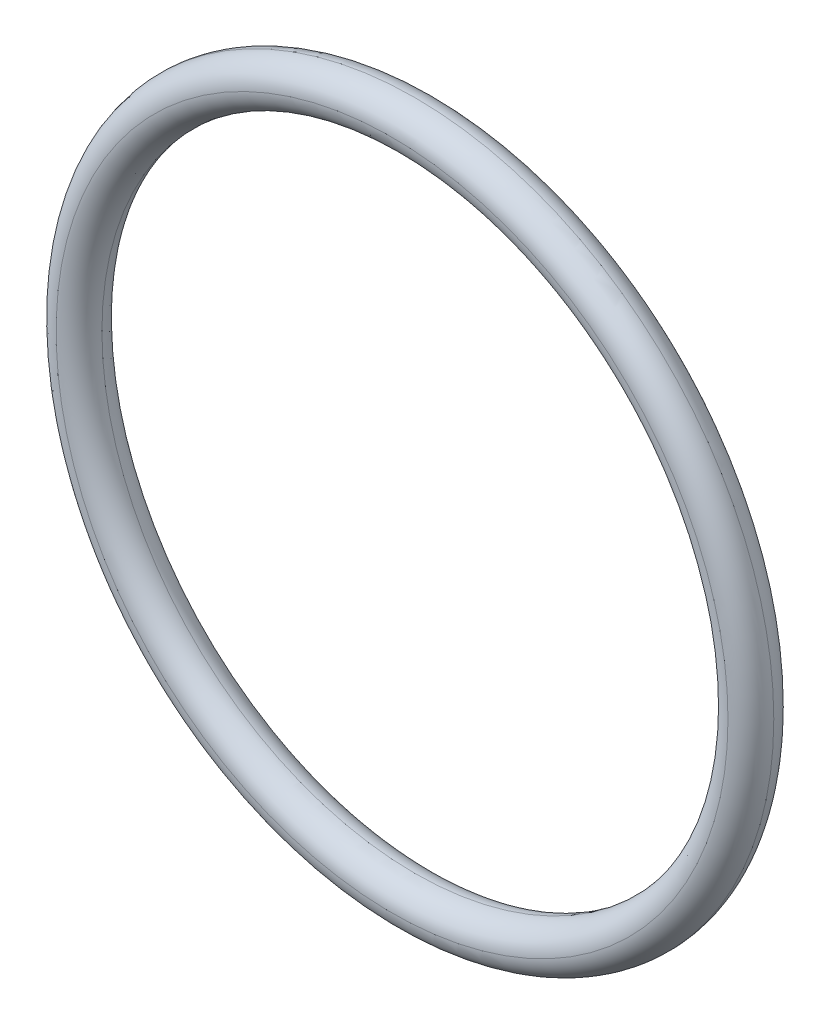
from build123d import *

# Parameters (mm, degrees)
SKETCH1_R               = 7.8613
SKETCH1_R_2             = 6.858
BOSS_EXTRUDE1_DEPTH     = 2.0066
CUT_EXTRUDE1_DEPTH      = 12.297190754
CUT_EXTRUDE1_DEPTH_BACK = 12.297190754
SKETCH2_W               = 1.0033
SKETCH2_H               = 15.7226
FILLET1_R               = 0.50165
FILLET2_R               = 0.50165


with BuildPart() as part:
    # Sketch1 → Boss-Extrude1 (new body)
    with BuildSketch(Plane.XY):
        Circle(SKETCH1_R)
        Circle(SKETCH1_R_2, mode=Mode.SUBTRACT)
    extrude(amount=-BOSS_EXTRUDE1_DEPTH)

    # Sketch2 → Cut-Extrude1 (cut, two sides: drawn at the far end of the back side and taken through both)
    with BuildSketch(Plane(origin=(0, 0, 0), x_dir=(0, 0, -1), z_dir=(1, 0, 0)).offset(-CUT_EXTRUDE1_DEPTH_BACK)):
        with Locations((1.50495, 0)):
            Rectangle(SKETCH2_W, SKETCH2_H)
    extrude(amount=CUT_EXTRUDE1_DEPTH + CUT_EXTRUDE1_DEPTH_BACK, mode=Mode.SUBTRACT)

    # Fillet1
    fillet1_edges = [part.edges().sort_by_distance(p)[0] for p in [
        (-6.858, 0, -1.0033),
        (-7.8613, 0, 0),
        (-6.858, 0, 0),
    ]]
    fillet(fillet1_edges, radius=FILLET1_R - 0.0001)  # a hair under: the kernel refuses the full size

    # Fillet2
    fillet2_edges = [part.edges().sort_by_distance(p)[0] for p in [
        (-7.8613, 0, -1.0033),
    ]]
    fillet(fillet2_edges, radius=FILLET2_R)


solid = part.part
